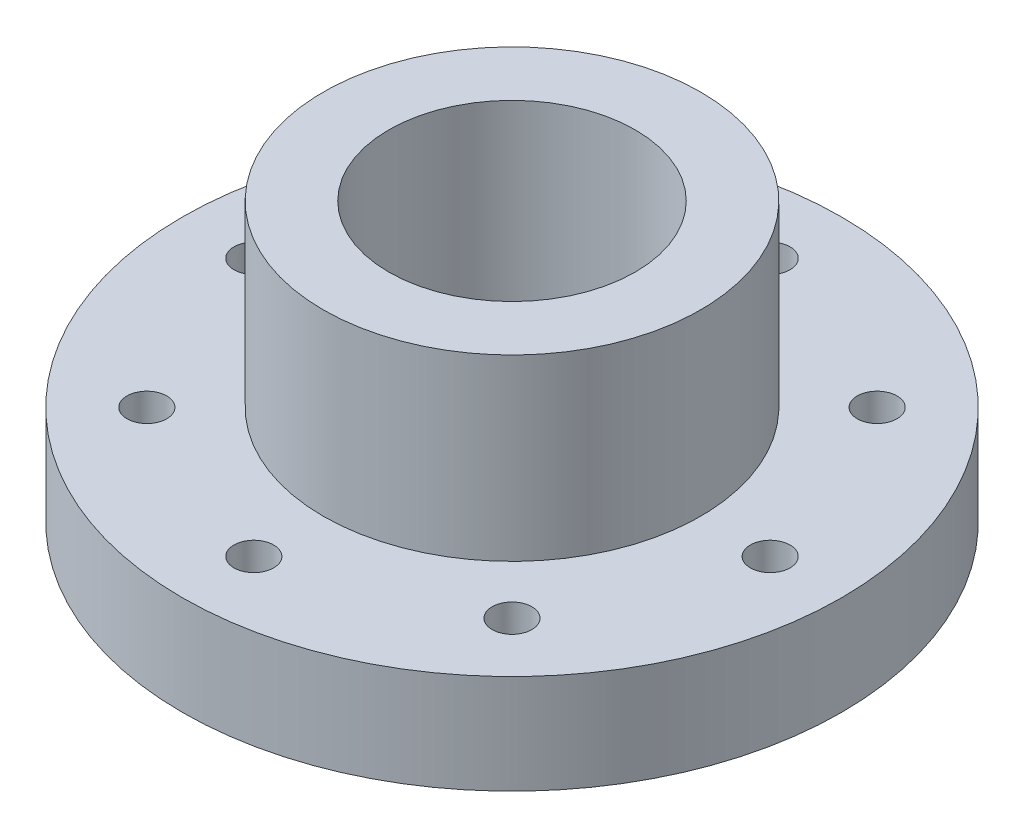
from build123d import *

# Parameters (mm, degrees)
SKETCH3_R            = 5
CUT_EXTRUDE2_DEPTH   = 137.667479672
SPLIT1_START         = 22.5
SPLIT1_OUTLINE_R     = 47.5
SPLIT1_OUTLINE_R_2   = 31.025
SPLIT1_DEPTH         = 47.5
SPLIT1_2_OUTLINE_R   = 47.5
SPLIT1_2_OUTLINE_R_2 = 31.025
SPLIT1_2_DEPTH       = 47.5


# Read off the part's stored shape, not the designer's step: Split1
with BuildPart() as part:
    # Sketch2 → Revolve1 (revolve)
    with BuildSketch(Plane.XY, mode=Mode.PRIVATE) as revolve1_sk:
        Polygon((83, 0), (55.1, 0), (55.1, 6), (25.5, 6), (25.5, 20), (31.025, 20), (31.025, 36), (31.025, 70), (32.5, 70), (47.5, 70), (47.5, 25), (83, 25), align=None)
    revolve(revolve1_sk.sketch.rotate(Axis((0, 0, 0), (0, 1, 0)), 90), axis=Axis((0, 0, 0), (0, 1, 0)))

    # Sketch3 → Cut-Extrude2 (cut, through all)
    with BuildSketch(Plane.XZ):
        with Locations(Location((65, 0, 0), (0, 0, 270))):
            Circle(SKETCH3_R)
        with Locations(Location((45.961940777, -45.961940777, 0), (0, 0, 270))):
            Circle(SKETCH3_R)
        with Locations(Location((0, -65, 0), (0, 0, 270))):
            Circle(SKETCH3_R)
        with Locations(Location((-45.961940777, -45.961940777, 0), (0, 0, 270))):
            Circle(SKETCH3_R)
        with Locations(Location((-65, 0, 0), (0, 0, 270))):
            Circle(SKETCH3_R)
        with Locations(Location((-45.961940777, 45.961940777, 0), (0, 0, 270))):
            Circle(SKETCH3_R)
        with Locations(Location((0, 65, 0), (0, 0, 270))):
            Circle(SKETCH3_R)
        with Locations(Location((45.961940777, 45.961940777, 0), (0, 0, 270))):
            Circle(SKETCH3_R)
    extrude(amount=-CUT_EXTRUDE2_DEPTH, mode=Mode.SUBTRACT)

    # Split1 outline → Split1 (cut)
    with BuildSketch(Plane(origin=(0, 0, 0), x_dir=(1, 0, 0), z_dir=(0, 1, 0)).offset(SPLIT1_START)):
        Circle(SPLIT1_OUTLINE_R)
        Circle(SPLIT1_OUTLINE_R_2, mode=Mode.SUBTRACT)
    extrude(amount=SPLIT1_DEPTH, mode=Mode.SUBTRACT)


with BuildPart() as body_2:
    # Split1 2 outline → Split1 2 (new body)
    with BuildSketch(Plane(origin=(0, 0, 0), x_dir=(1, 0, 0), z_dir=(0, 1, 0)).offset(SPLIT1_START)):
        Circle(SPLIT1_2_OUTLINE_R)
        Circle(SPLIT1_2_OUTLINE_R_2, mode=Mode.SUBTRACT)
    extrude(amount=SPLIT1_2_DEPTH)


solid = Compound([part.part, body_2.part])
